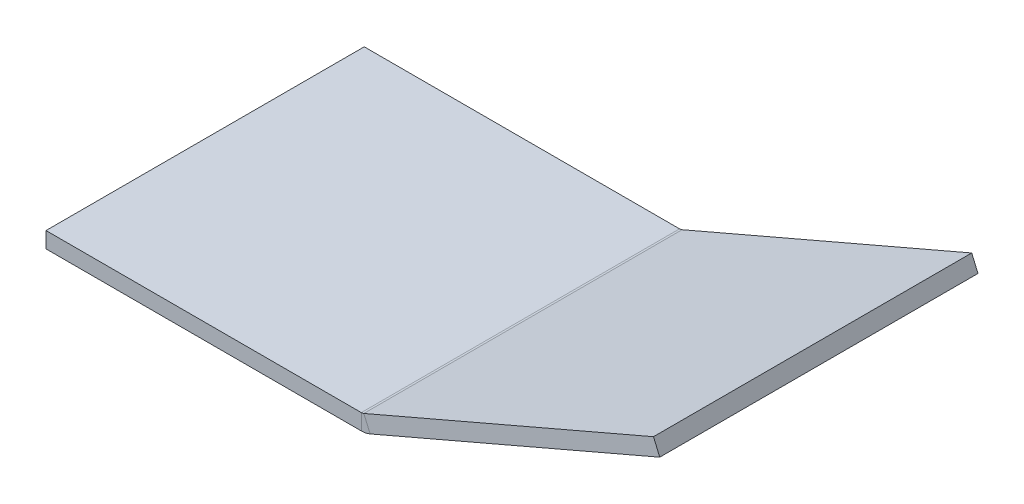
from build123d import *

# Parameters (mm, degrees)
SKETCH1_W              = 100
SKETCH1_H              = 50
BASE_FLANGE1_DEPTH     = 2.5
SKETCHED_START         = -25
SKETCHED_BEND3_DEPTH   = 50
SKETCHED_BEND3_2_DEPTH = 50


# Read off the part's stored shape, not the designer's step: Sketched Bend3
# Sheet-metal steps are written as plain solids
with BuildPart() as part:
    # Sketch1 → Base-Flange1 (new body)
    with BuildSketch(Plane(origin=(0, 0, 0), x_dir=(1, 0, 0), z_dir=(0, 1, 0))):
        Rectangle(SKETCH1_W, SKETCH1_H)
    extrude(amount=-BASE_FLANGE1_DEPTH)

    # Sketched Bend3 outline → Sketched Bend3 (cut)
    with BuildSketch(Plane.XY.offset(SKETCHED_START)):
        with BuildLine():
            Line((50, 0), (6.071738955, 0))
            Line((6.071738955, 0), (0.92655011, -2.214803911))
            ThreePointArc((0.92655011, -2.214803911), (0.249167174, -2.427959574), (-0.457298081, -2.5))
            Line((-0.457298081, -2.5), (50, -2.5))
            Line((50, -2.5), (50, 0))
        make_face()
    extrude(amount=SKETCHED_BEND3_DEPTH, mode=Mode.SUBTRACT)

    # Sketched Bend3 2 outline → Sketched Bend3 2 (add)
    with BuildSketch(Plane.XY.offset(SKETCHED_START)):
        with BuildLine():
            Line((46.432284933, 17.373647068), (45.443821939, 19.669935575))
            Line((45.443821939, 19.669935575), (-0.061912883, 0.081484597))
            ThreePointArc((-0.061912883, 0.081484597), (-0.255450865, 0.020582979), (-0.457298081, 0))
            Line((-0.457298081, 0), (6.071738955, 0))
            Line((6.071738955, 0), (46.432284933, 17.373647068))
        make_face()
    extrude(amount=SKETCHED_BEND3_2_DEPTH)


solid = part.part
